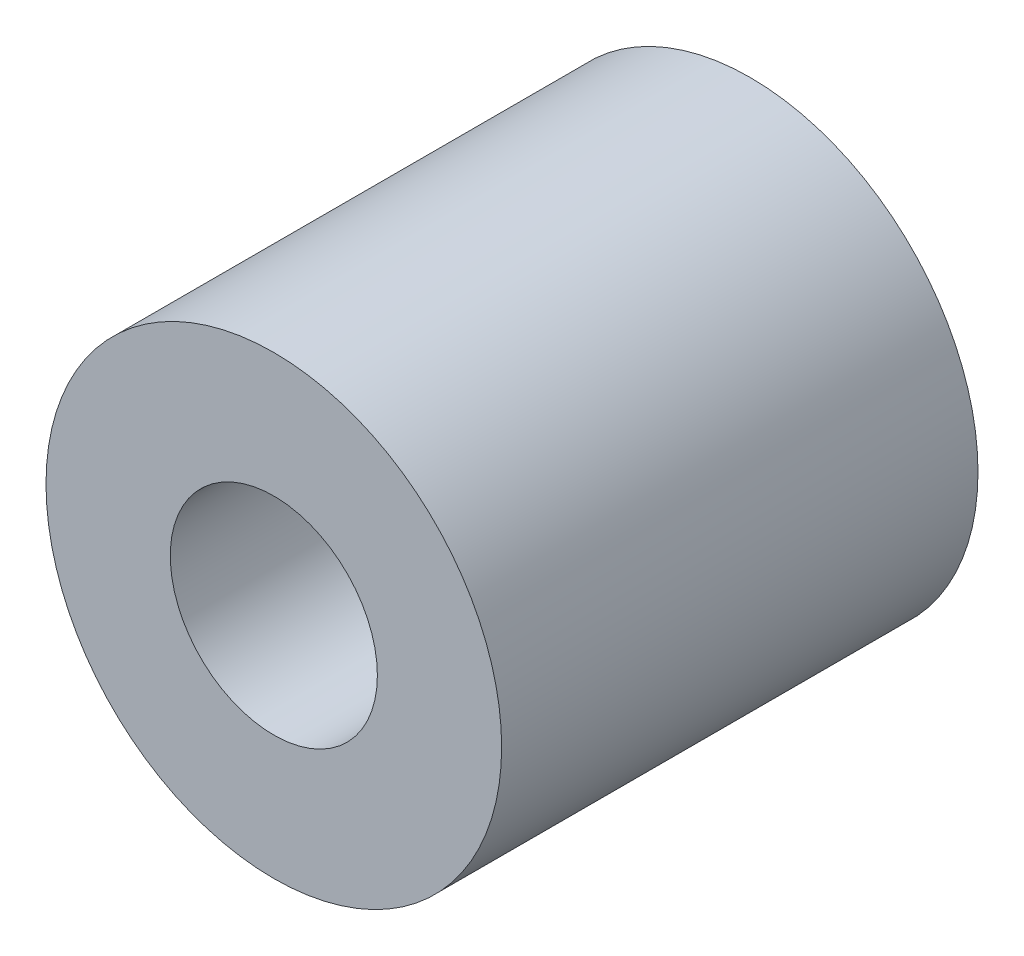
from build123d import *

# Parameters (mm, degrees)
SKETCH1_R           = 5.5
SKETCH1_R_2         = 2.5
BOSS_EXTRUDE1_DEPTH = 11.5


with BuildPart() as part:
    # Sketch1 → Boss-Extrude1 (new body)
    with BuildSketch(Plane.XY):
        Circle(SKETCH1_R)
        Circle(SKETCH1_R_2, mode=Mode.SUBTRACT)
    extrude(amount=BOSS_EXTRUDE1_DEPTH)


solid = part.part
